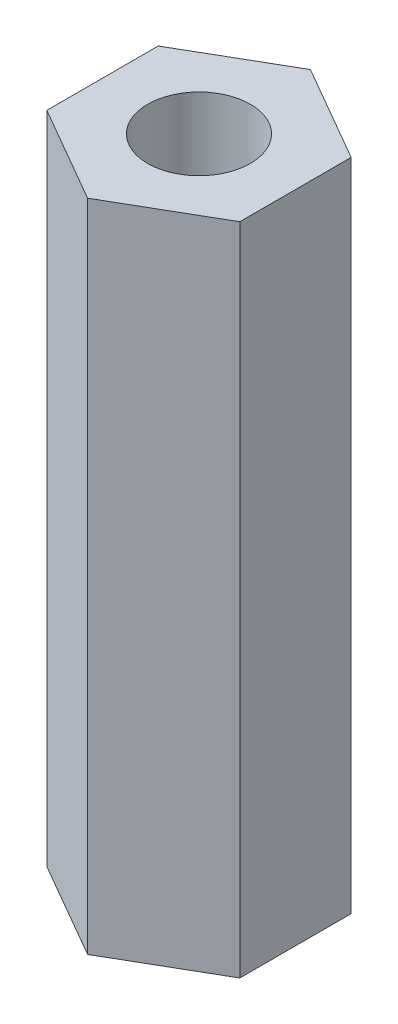
from build123d import *

# Parameters (mm, degrees)
SKETCH1_R           = 1.45
BOSS_EXTRUDE1_DEPTH = 18.5


with BuildPart() as part:
    # Sketch1 → Boss-Extrude1 (new body)
    with BuildSketch(Plane(origin=(0, 0, 0), x_dir=(1, 0, 0), z_dir=(0, 1, 0))):
        Polygon((0, 3.146558967), (-2.725, 1.573279484), (-2.725, -1.573279484), (0, -3.146558967), (2.725, -1.573279484), (2.725, 1.573279484), align=None)
        Circle(SKETCH1_R, mode=Mode.SUBTRACT)
    extrude(amount=BOSS_EXTRUDE1_DEPTH)


solid = part.part
